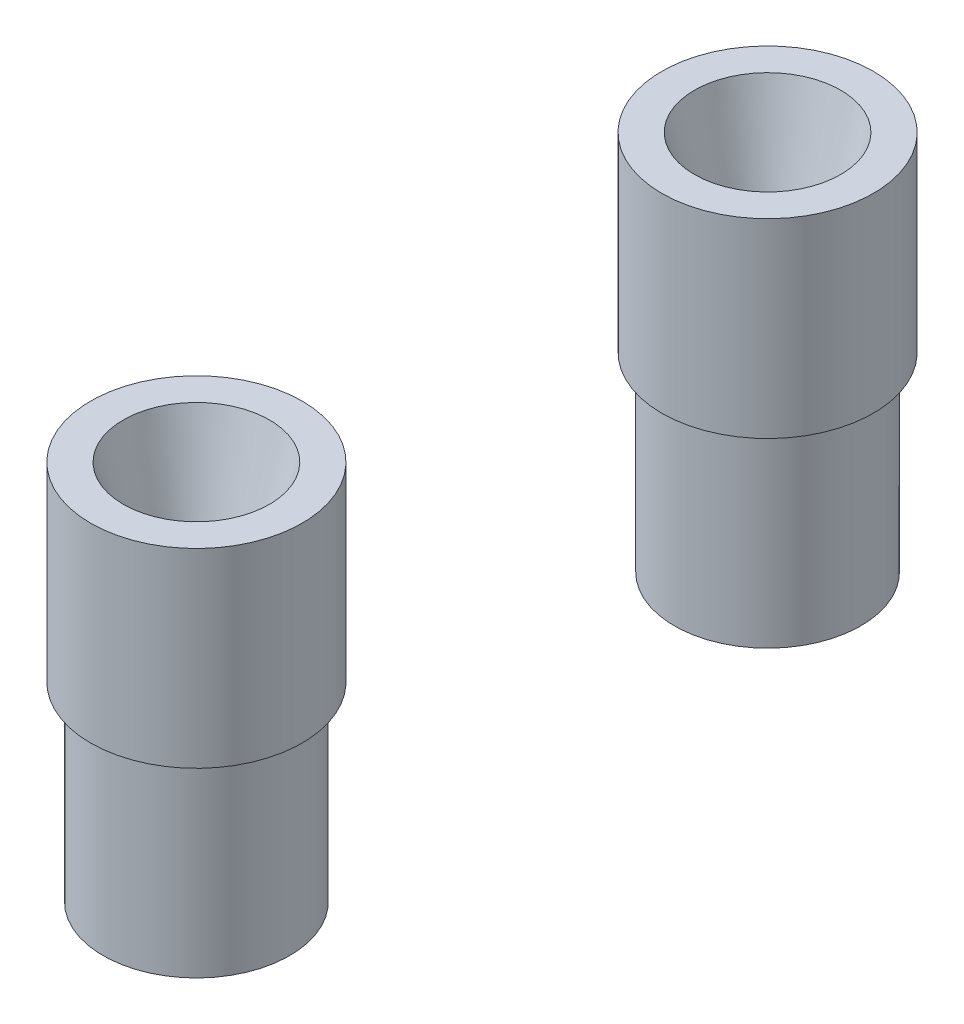
from build123d import *

# Parameters (mm, degrees)
SKETCH2_R          = 2.5
CUT_EXTRUDE1_DEPTH = 5
DRAFT1_ANGLE       = 15


with BuildPart() as part:
    # Sketch1 → Revolve1 (revolve)
    with BuildSketch(Plane.XY):
        Polygon((0, 20), (5.55625, 20), (5.55625, 10), (4.9, 10), (4.9, 0), (0, 0), align=None)
    revolve(axis=Axis((0, 0, 0), (0, 1, 0)))

    # Sketch2 → Cut-Extrude1 (cut)
    with BuildSketch(Plane(origin=(0, 20, 0), x_dir=(1, 0, 0), z_dir=(0, 1, 0))):
        Circle(SKETCH2_R)
    extrude(amount=-CUT_EXTRUDE1_DEPTH, mode=Mode.SUBTRACT)

    # Draft1
    draft1_faces = [part.faces().sort_by_distance(p)[0] for p in [
        (-2.5, 17.5, 0),
    ]]
    draft(draft1_faces, Plane.ZX.offset(15), DRAFT1_ANGLE)


with BuildPart() as body_2:
    # Body-Move/Copy1: copy of part
    add(part.part.moved(Location((0, 0, 30))))


solid = Compound([part.part, body_2.part])
